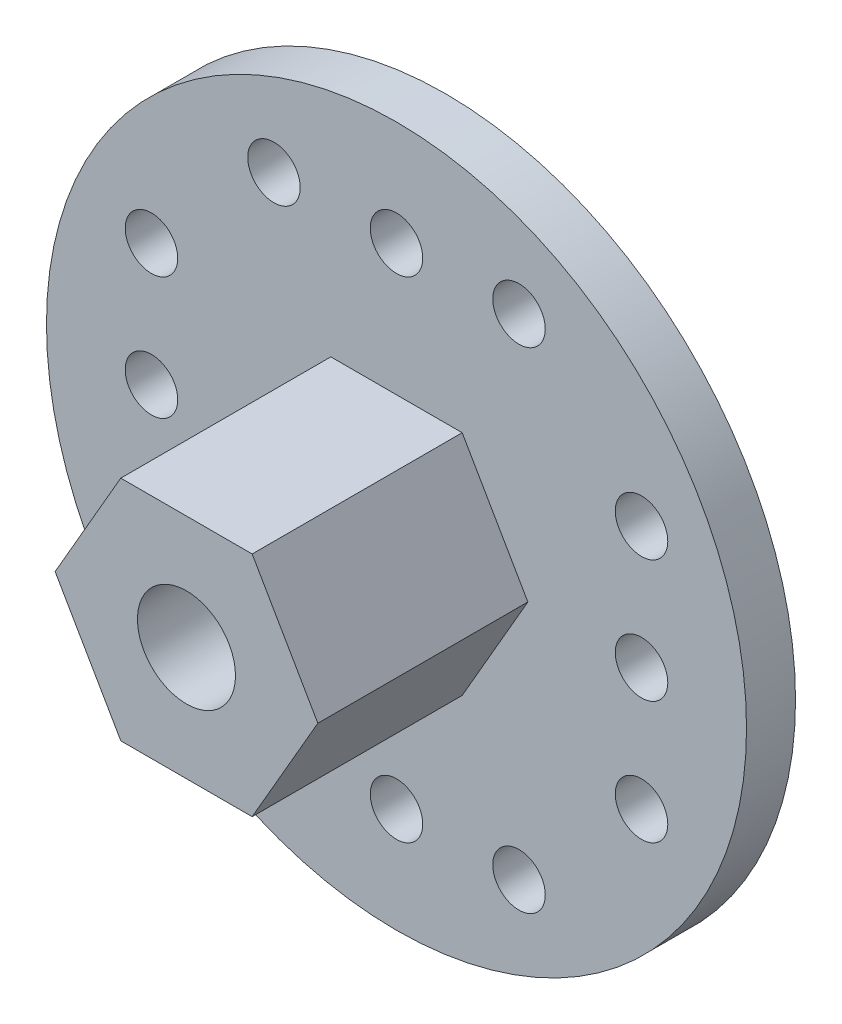
from build123d import *

# Parameters (mm, degrees)
SKETCH1_R           = 10
SKETCH1_R_2         = 0.75
BOSS_EXTRUDE1_DEPTH = 1.4
BOSS_EXTRUDE2_DEPTH = 6
SKETCH3_R           = 3.25
CUT_EXTRUDE1_DEPTH  = 0.4
SKETCH4_R           = 1.4
CUT_EXTRUDE2_DEPTH  = 5


with BuildPart() as part:
    # Sketch1 → Boss-Extrude1 (new body)
    with BuildSketch(Plane.XY):
        with Locations((0.775849774, -0.387924887)):
            Circle(SKETCH1_R)
        with Locations((-6.224150226, -0.387924887)):
            Circle(SKETCH1_R_2, mode=Mode.SUBTRACT)
        with Locations((4.275849774, 6.612075113)):
            Circle(SKETCH1_R_2, mode=Mode.SUBTRACT)
        with Locations((0.775849774, 6.612075113)):
            Circle(SKETCH1_R_2, mode=Mode.SUBTRACT)
        with Locations((-2.724150226, 6.612075113)):
            Circle(SKETCH1_R_2, mode=Mode.SUBTRACT)
        with Locations((7.775849774, -3.887924887)):
            Circle(SKETCH1_R_2, mode=Mode.SUBTRACT)
        with Locations((7.775849774, -0.387924887)):
            Circle(SKETCH1_R_2, mode=Mode.SUBTRACT)
        with Locations((7.775849774, 3.112075113)):
            Circle(SKETCH1_R_2, mode=Mode.SUBTRACT)
        with Locations((-2.724150226, -7.387924887)):
            Circle(SKETCH1_R_2, mode=Mode.SUBTRACT)
        with Locations((0.775849774, -7.387924887)):
            Circle(SKETCH1_R_2, mode=Mode.SUBTRACT)
        with Locations((4.275849774, -7.387924887)):
            Circle(SKETCH1_R_2, mode=Mode.SUBTRACT)
        with Locations((-6.224150226, -3.887924887)):
            Circle(SKETCH1_R_2, mode=Mode.SUBTRACT)
        with Locations((-6.224150226, 3.112075113)):
            Circle(SKETCH1_R_2, mode=Mode.SUBTRACT)
    extrude(amount=BOSS_EXTRUDE1_DEPTH)

    # Sketch2 → Boss-Extrude2 (add)
    with BuildSketch(Plane.XY.offset(1.4)):
        Polygon((4.528626524, -0.387924887), (2.652238149, 2.862075113), (-1.100538601, 2.862075113), (-2.976926976, -0.387924887), (-1.100538601, -3.637924887), (2.652238149, -3.637924887), align=None)
    extrude(amount=BOSS_EXTRUDE2_DEPTH)

    # Sketch3 → Cut-Extrude1 (cut)
    with BuildSketch(Plane(origin=(0, 0, 0), x_dir=(-1, 0, 0), z_dir=(0, 0, -1))):
        with Locations((-0.775849774, -0.387924887)):
            Circle(SKETCH3_R)
    extrude(amount=-CUT_EXTRUDE1_DEPTH, mode=Mode.SUBTRACT)

    # Sketch4 → Cut-Extrude2 (cut)
    with BuildSketch(Plane.XY.offset(7.4)):
        with Locations((0.775849774, -0.387924887)):
            Circle(SKETCH4_R)
    extrude(amount=-CUT_EXTRUDE2_DEPTH, mode=Mode.SUBTRACT)


solid = part.part
